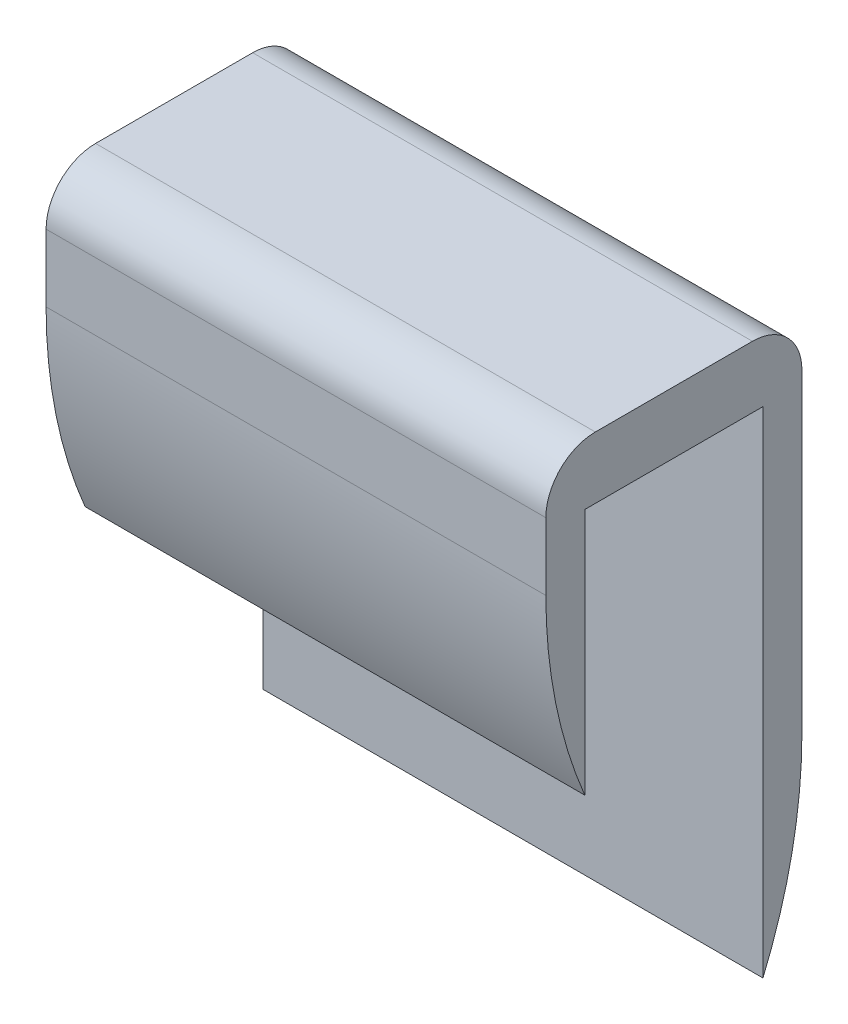
from build123d import *

# Parameters (mm, degrees)
BOSS_EXTRUDE1_DEPTH = 25.654
FILLET1_R           = 25.4
FILLET2_R           = 2.54


with BuildPart() as part:
    # Sketch1 → Boss-Extrude1 (new body)
    with BuildSketch(Plane(origin=(0, 0, 0), x_dir=(0, 0, -1), z_dir=(1, 0, 0))):
        Polygon((-6.572, -12.7), (-4.572, -12.7), (-4.572, 0), (4.572, 0), (4.572, -25.4), (6.572, -25.4), (6.572, 3.175), (-6.572, 3.175), align=None)
    extrude(amount=BOSS_EXTRUDE1_DEPTH)

    # Fillet1
    # the kernel refuses this fillet: 25.4 mm, written as the material it takes off along each edge
    with BuildSketch(Plane(origin=(-24.69817807, -12.7, 6.572), x_dir=(0, 0, -1), z_dir=(1, 0, 0))) as fillet1_piece_1:
        with BuildLine():
            CenterArc((25.4, 9.879271228), FILLET1_R, 180, 22.889037196)
            Line((0, 9.879271228), (-0.508, 9.879271228))
            Line((-0.508, 9.879271228), (-0.508, 0))
            Line((-0.508, 0), (0, -0.508))
            ThreePointArc((0, -0.508), (1, -0.508), (1.532, -0.197585425))
            Line((1.532, -0.197585425), (2, 0))
        make_face()
    extrude(amount=75.050356141, mode=Mode.SUBTRACT)
    with BuildSketch(Plane(origin=(-24.69817807, -25.4, -6.572), x_dir=(0, 0, 1), z_dir=(1, 0, 0))) as fillet1_piece_2:
        with BuildLine():
            CenterArc((25.4, -9.879271228), FILLET1_R, 157.110962804, 22.889037196)
            Line((0, -9.879271228), (-0.508, -9.879271228))
            Line((-0.508, -9.879271228), (-0.508, 0))
            Line((-0.508, 0), (0, 0.508))
            ThreePointArc((0, 0.508), (1, 0.508), (1.532, 0.197585425))
            Line((1.532, 0.197585425), (2, 0))
        make_face()
    extrude(amount=75.050356141, mode=Mode.SUBTRACT)

    # Fillet2
    fillet2_edges = [part.edges().sort_by_distance(p)[0] for p in [
        (12.827, 3.175, 6.572),
        (12.827, 3.175, -6.572),
    ]]
    fillet(fillet2_edges, radius=FILLET2_R)


solid = part.part
